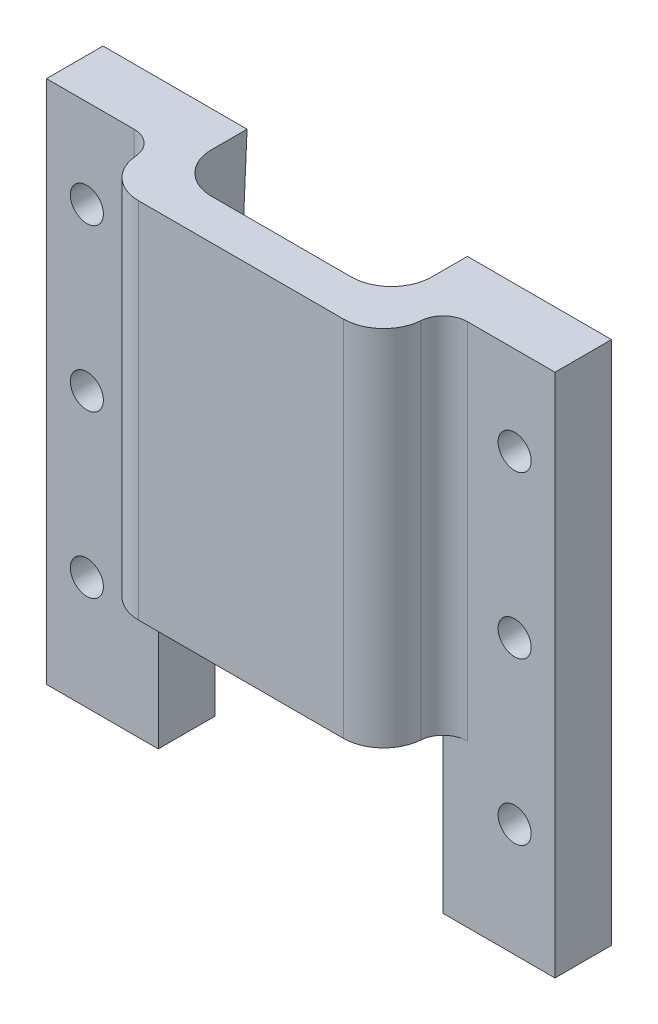
from build123d import *

# Parameters (mm, degrees)
SKETCH1_W           = 63
SKETCH1_H           = 65
BOSS_EXTRUDE1_DEPTH = 35
SKETCH4_W           = 13.85
SKETCH4_H           = 28
CUT_EXTRUDE1_DEPTH  = 81.26362829
SKETCH6_R           = 2.05
CUT_EXTRUDE2_DEPTH  = 35
SKETCH7_W           = 35.3
SKETCH7_H           = 20
CUT_EXTRUDE3_DEPTH  = 58.214508823
SKETCH5_W           = 43.787246082
SKETCH5_H           = 26.488580963
CUT_EXTRUDE4_DEPTH  = 81.26362829
FILLET1_R           = 3
FILLET2_R           = 5


with BuildPart() as part:
    # Sketch1 → Boss-Extrude1 (new body)
    with BuildSketch(Plane.XY):
        Rectangle(SKETCH1_W, SKETCH1_H)
    extrude(amount=BOSS_EXTRUDE1_DEPTH)

    # Cut-Loft1: read off the stored shape, not the designer's step
    # Cut-Loft1: loft between two sections, ruled curve by curve
    cut_loft1_from = [
        Edge.make_bspline([(-16.5, -32.5, -15.95), (-16.5, -32.5, -14.245344374), (-16.5, -32.5, -10.830534175), (-16.5, -32.5, -5.7), (-16.5, -32.5, -0.569465825), (-16.5, -32.5, 2.845344374), (-16.5, -32.5, 5.208176172), (-16.24079277, -32.5, 6.487165764), (-15.189486136, -32.5, 8.102764154), (-13.584460954, -32.5, 9.238586175), (-12.225257815, -32.5, 9.55), (-9.654092683, -32.5, 9.55), (-5.862169747, -32.5, 9.55), (0, -32.5, 9.55), (5.862169747, -32.5, 9.55), (9.654092683, -32.5, 9.55), (12.225257815, -32.5, 9.55), (13.584460954, -32.5, 9.238586175), (15.189486136, -32.5, 8.102764154), (16.24079277, -32.5, 6.487165764), (16.5, -32.5, 5.208176172), (16.5, -32.5, 4.55)], [0, 0, 0, 0, 0.090746911, 0.181493823, 0.272240734, 0.362987645, 0.362987645, 0.398025487, 0.43306333, 0.468101172, 0.503139015, 0.503139015, 0.592316419, 0.681493823, 0.770671227, 0.859848631, 0.859848631, 0.894886473, 0.929924315, 0.964962158, 1, 1, 1, 1], 3),
        Edge.make_line((16.5, -32.5, 0), (16.5, -32.5, 4.55)),
        Edge.make_line((16.5, -32.5, 0), (-16.5, -32.5, -15.95)),
    ]
    cut_loft1_to = [
        Edge.make_bspline([(-13.65, 32.5, -15.8), (-13.65, 32.5, -14.113380525), (-13.65, 32.5, -10.745084998), (-13.65, 32.5, -5.7), (-13.65, 32.5, -0.654915002), (-13.65, 32.5, 2.713380525), (-13.65, 32.5, 5.051212323), (-13.38927185, 32.5, 6.394463384), (-12.20097724, 32.5, 8.116532102), (-10.480556624, 32.5, 9.187425671), (-9.241272853, 32.5, 9.4), (-7.145107721, 32.5, 9.4), (-4.236047985, 32.5, 9.4), (0, 32.5, 9.4), (4.236047985, 32.5, 9.4), (7.145107721, 32.5, 9.4), (9.241272853, 32.5, 9.4), (10.480556624, 32.5, 9.187425671), (12.20097724, 32.5, 8.116532102), (13.38927185, 32.5, 6.394463384), (13.65, 32.5, 5.051212323), (13.65, 32.5, 4.4)], [0, 0, 0, 0, 0.090746911, 0.181493823, 0.272240734, 0.362987645, 0.362987645, 0.398025487, 0.43306333, 0.468101172, 0.503139015, 0.503139015, 0.592316419, 0.681493823, 0.770671227, 0.859848631, 0.859848631, 0.894886473, 0.929924315, 0.964962158, 1, 1, 1, 1], 3),
        Edge.make_line((13.65, 32.5, 0), (13.65, 32.5, 4.4)),
        Edge.make_line((13.65, 32.5, 0), (-13.65, 32.5, -15.8)),
    ]
    cut_loft1 = Solid(Shell([*[Face.make_surface_from_curves(cut_loft1_from[k], cut_loft1_to[k]) for k in range(3)], Face(Wire(cut_loft1_from)), Face(Wire(cut_loft1_to))]))
    add(cut_loft1, mode=Mode.SUBTRACT)

    # Sketch4 → Cut-Extrude1 (cut, through all)
    with BuildSketch(Plane(origin=(0, 32.5, 0), x_dir=(1, 0, 0), z_dir=(0, 1, 0))):
        with Locations((24.575, -21)):
            Rectangle(SKETCH4_W, SKETCH4_H)
        with Locations((-24.575, -21)):
            Rectangle(SKETCH4_W, SKETCH4_H)
    extrude(amount=-CUT_EXTRUDE1_DEPTH, mode=Mode.SUBTRACT)

    # Sketch6 → Cut-Extrude2 (cut)
    with BuildSketch(Plane(origin=(0, 0, 0), x_dir=(-1, 0, 0), z_dir=(0, 0, -1))):
        with Locations((-26.5, -18.5)):
            Circle(SKETCH6_R)
        with Locations((-26.5, 1.5)):
            Circle(SKETCH6_R)
        with Locations((-26.5, 21.5)):
            Circle(SKETCH6_R)
        with Locations((26.5, -18.5)):
            Circle(SKETCH6_R)
        with Locations((26.5, 1.5)):
            Circle(SKETCH6_R)
        with Locations((26.5, 21.5)):
            Circle(SKETCH6_R)
    extrude(amount=-CUT_EXTRUDE2_DEPTH, mode=Mode.SUBTRACT)

    # Sketch7 → Cut-Extrude3 (cut, through all)
    with BuildSketch(Plane.XY.offset(35)):
        with Locations((0, -22.5)):
            Rectangle(SKETCH7_W, SKETCH7_H)
    extrude(amount=-CUT_EXTRUDE3_DEPTH, mode=Mode.SUBTRACT)

    # Sketch5 → Cut-Extrude4 (cut, through all)
    with BuildSketch(Plane(origin=(0, 32.5, 0), x_dir=(1, 0, 0), z_dir=(0, 1, 0))):
        with Locations((-0.216233314, -27.644290482)):
            Rectangle(SKETCH5_W, SKETCH5_H)
    extrude(amount=-CUT_EXTRUDE4_DEPTH, mode=Mode.SUBTRACT)

    # Fillet1
    fillet1_edges = [part.edges().sort_by_distance(p)[0] for p in [
        (17.65, 10, 7),
        (-17.65, 10, 7),
    ]]
    fillet(fillet1_edges, radius=FILLET1_R)

    # Fillet2
    fillet2_edges = [part.edges().sort_by_distance(p)[0] for p in [
        (-17.65, 10, 14.4),
        (17.65, 10, 14.4),
    ]]
    fillet(fillet2_edges, radius=FILLET2_R)


solid = part.part
